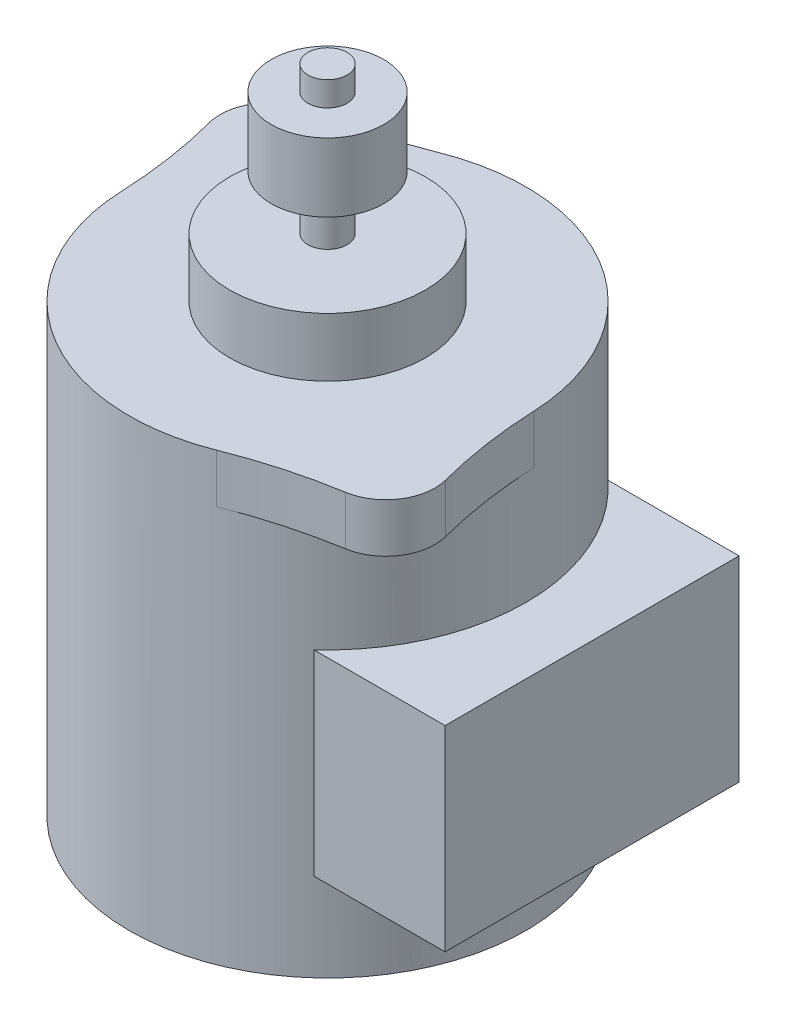
from build123d import *

# Parameters (mm, degrees)
SKETCH1_R                = 4.05
BOSS_EXTRUDE1_DEPTH      = 8.1
BOSS_EXTRUDE2_DEPTH      = 1
FILLET1_R                = 10
SKETCH3_R                = 2
BOSS_EXTRUDE3_DEPTH      = 1.2
SKETCH4_R                = 0.4
BOSS_EXTRUDE4_DEPTH      = 3
BOSS_EXTRUDE5_START      = -0.5
SKETCH5_R                = 1.15
BOSS_EXTRUDE5_DEPTH      = 1.4
BOSS_EXTRUDE6_REACH      = 19.008
BOSS_EXTRUDE6_END_RADIUS = 4.05
SKETCH6_W                = 6
SKETCH6_H                = 4


with BuildPart() as part:
    # Sketch1 → Boss-Extrude1 (new body)
    with BuildSketch(Plane(origin=(0, 0, 0), x_dir=(1, 0, 0), z_dir=(0, 1, 0))):
        with Locations(Location((0, 0, 0), (0, 0, 270))):
            Circle(SKETCH1_R)
    extrude(amount=BOSS_EXTRUDE1_DEPTH)

    # Sketch2 → Boss-Extrude2 (add)
    with BuildSketch(Plane(origin=(0, 8.1, 0), x_dir=(1, 0, 0), z_dir=(0, 1, 0))):
        with BuildLine():
            ThreePointArc((-3.833548742, 1.30629401), (-2.205788092, -3.3966158), (2.752603705, -2.9708034))
            ThreePointArc((2.752603705, -2.9708034), (4.235286368, -2.750427127), (3.833548742, -1.30629401))
            ThreePointArc((3.833548742, -1.30629401), (2.205788092, 3.3966158), (-2.752603705, 2.9708034))
            ThreePointArc((-2.752603705, 2.9708034), (-4.235286368, 2.750427127), (-3.833548742, 1.30629401))
        make_face()
    extrude(amount=BOSS_EXTRUDE2_DEPTH)

    # Fillet1
    # the kernel refuses this fillet: 10 mm, written as the material it adds along each edge
    with BuildSketch(Plane(origin=(-2.752603705, 8.1, -2.9708034), x_dir=(0.8459561601363162, 0, -0.5332524497153475), z_dir=(0, 1, 0)), Plane(origin=(2.752603705, 8.1, 2.9708034), x_dir=(-0.8459561601363164, 0, 0.5332524497153472), z_dir=(0, 1, 0))) as fillet1_piece_1:
        with BuildLine():
            CenterArc((3.326797297, 9.829634829), FILLET1_R, 247.104601823, 12.304164649)
            ThreePointArc((-0.563702324, 0.617468271), (-0.214223286, 0.370473326), (0, 0))
            ThreePointArc((0, 0), (0.74439387, 0.068997894), (1.488787741, 0))
        make_face()
    extrude(amount=1)
    with BuildSketch(Plane(origin=(-3.833548742, 8.1, -1.30629401), x_dir=(-0.14306898445110627, 0, 0.9897127187664757), z_dir=(0, 1, 0)), Plane(origin=(3.833548742, 8.1, 1.30629401), x_dir=(0.14306898445110644, 0, -0.9897127187664757), z_dir=(0, 1, 0))) as fillet1_piece_2:
        with BuildLine():
            CenterArc((3.326797297, -9.829634829), FILLET1_R, 100.591233529, 12.304164649)
            ThreePointArc((-0.563702324, -0.617468271), (-0.214223286, -0.370473326), (0, 0))
            ThreePointArc((0, 0), (0.74439387, -0.068997894), (1.488787741, 0))
        make_face()
    extrude(amount=1)

    # Sketch3 → Boss-Extrude3 (add)
    with BuildSketch(Plane(origin=(0, 9.1, 0), x_dir=(1, 0, 0), z_dir=(0, 1, 0))):
        with Locations(Location((0, 0, 0), (0, 0, 270))):
            Circle(SKETCH3_R)
    extrude(amount=BOSS_EXTRUDE3_DEPTH)

    # Sketch4 → Boss-Extrude4 (add)
    with BuildSketch(Plane(origin=(0, 10.3, 0), x_dir=(1, 0, 0), z_dir=(0, 1, 0))):
        with Locations(Location((0, 0, 0), (0, 0, 270))):
            Circle(SKETCH4_R)
    extrude(amount=BOSS_EXTRUDE4_DEPTH)

    # Sketch5 → Boss-Extrude5 (add)
    with BuildSketch(Plane(origin=(0, 13.3, 0), x_dir=(1, 0, 0), z_dir=(0, 1, 0)).offset(BOSS_EXTRUDE5_START)):
        with Locations(Location((0, 0, 0), (0, 0, 270))):
            Circle(SKETCH5_R)
    extrude(amount=-BOSS_EXTRUDE5_DEPTH)

    # Boss-Extrude6: up to this cylinder (the profile starts outside it)
    boss_extrude6_end = Plane(origin=(0, 3.8, 0), z_dir=(0, -1, 0)) * Cylinder(BOSS_EXTRUDE6_END_RADIUS, 47.116, mode=Mode.PRIVATE)
    # Sketch6 → Boss-Extrude6 (add, up to the surface)
    with BuildSketch(Plane(origin=(5.4, 0, 0), x_dir=(0, 0, -1), z_dir=(1, 0, 0)), mode=Mode.PRIVATE) as boss_extrude6_sk1:
        with Locations((0, 3.8)):
            Rectangle(SKETCH6_W, SKETCH6_H)
    boss_extrude6_tool1 = extrude(boss_extrude6_sk1.sketch, amount=-BOSS_EXTRUDE6_REACH, mode=Mode.PRIVATE) - boss_extrude6_end
    add(boss_extrude6_tool1.solids().sort_by_distance((5.4, 3.8, 0))[0])


solid = part.part
